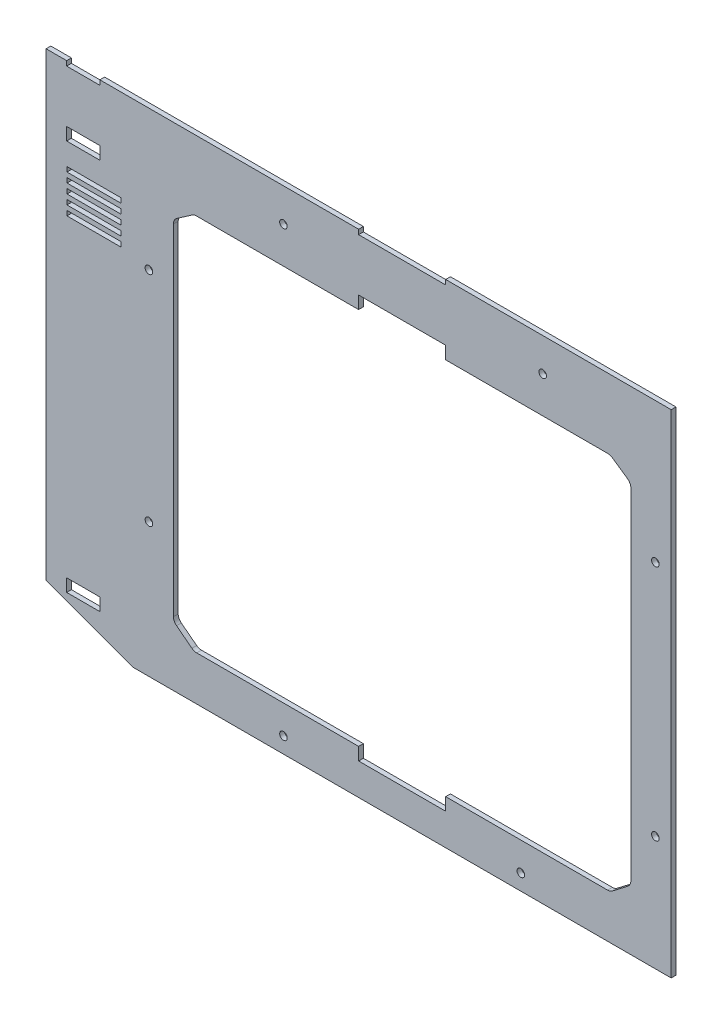
from build123d import *

# Parameters (mm, degrees)
SCHIZZO1_R                   = 2.4
SCHIZZO1_W                   = 21
SCHIZZO1_H                   = 8
ESTRUSIONE_ESTRUSIONE1_DEPTH = 3
RACCORDO1_R                  = 5
SCHIZZO2_W                   = 34
SCHIZZO2_H                   = 3
TAGLIO_ESTRUSIONE1_DEPTH     = 10


with BuildPart() as part:
    # Schizzo1 → Estrusione-Estrusione1 (new body)
    with BuildSketch(Plane.XY):
        Polygon((-170, -155.5), (170, -155.5), (170, 155.5), (27.5, 155.5), (27.5, 152.5), (-27.5, 152.5), (-27.5, 155.5), (-191, 155.5), (-191, 152.5), (-212, 152.5), (-212, 155.5), (-225, 155.5), (-225, -135.5), align=None)
        Polygon((-131.5, -127.5), (-144.5, -117.5), (-144.5, 102.5), (-131.5, 111.5), (-27.5, 111.5), (-27.5, 119.5), (27.5, 119.5), (27.5, 111.5), (131.5, 111.5), (144.5, 102.5), (144.5, -117.5), (131.5, -127.5), (27.5, -127.5), (27.5, -135.5), (-27.5, -135.5), (-27.5, -127.5), align=None, mode=Mode.SUBTRACT)
        with Locations((-75, -145.5)):
            Circle(SCHIZZO1_R, mode=Mode.SUBTRACT)
        with Locations((-160, -70.821088207)):
            Circle(SCHIZZO1_R, mode=Mode.SUBTRACT)
        with Locations((75, -145.5)):
            Circle(SCHIZZO1_R, mode=Mode.SUBTRACT)
        with Locations((160, -83)):
            Circle(SCHIZZO1_R, mode=Mode.SUBTRACT)
        with Locations((160, 67)):
            Circle(SCHIZZO1_R, mode=Mode.SUBTRACT)
        with Locations((88.808551523, 134.5)):
            Circle(SCHIZZO1_R, mode=Mode.SUBTRACT)
        with Locations((-160, 67)):
            Circle(SCHIZZO1_R, mode=Mode.SUBTRACT)
        with Locations((-75, 134.5)):
            Circle(SCHIZZO1_R, mode=Mode.SUBTRACT)
        with Locations((-201.5, 115.5)):
            Rectangle(SCHIZZO1_W, SCHIZZO1_H, mode=Mode.SUBTRACT)
        with Locations((-201.5, -131.5)):
            Rectangle(SCHIZZO1_W, SCHIZZO1_H, mode=Mode.SUBTRACT)
    extrude(amount=ESTRUSIONE_ESTRUSIONE1_DEPTH)

    # Raccordo1
    raccordo1_edges = [part.edges().sort_by_distance(p)[0] for p in [
        (-144.5, -117.5, 1.5),
        (-131.5, -127.5, 1.5),
        (131.5, -127.5, 1.5),
        (144.5, -117.5, 1.5),
        (144.5, 102.5, 1.5),
        (131.5, 111.5, 1.5),
        (-131.5, 111.5, 1.5),
        (-144.5, 102.5, 1.5),
    ]]
    fillet(raccordo1_edges, radius=RACCORDO1_R)

    # Schizzo2 → Taglio-Estrusione1 (cut)
    with BuildSketch(Plane(origin=(0, 0, 0), x_dir=(-1, 0, 0), z_dir=(0, 0, -1))):
        with Locations((194.776013315, 96.134935208)):
            Rectangle(SCHIZZO2_W, SCHIZZO2_H)
        with Locations((194.776013315, 90.134935208)):
            Rectangle(SCHIZZO2_W, SCHIZZO2_H)
        with Locations((194.776013315, 84.134935208)):
            Rectangle(SCHIZZO2_W, SCHIZZO2_H)
        with Locations((194.776013315, 78.134935208)):
            Rectangle(SCHIZZO2_W, SCHIZZO2_H)
        with Locations((194.776013315, 72.134935208)):
            Rectangle(SCHIZZO2_W, SCHIZZO2_H)
    extrude(amount=-TAGLIO_ESTRUSIONE1_DEPTH, mode=Mode.SUBTRACT)


solid = part.part
